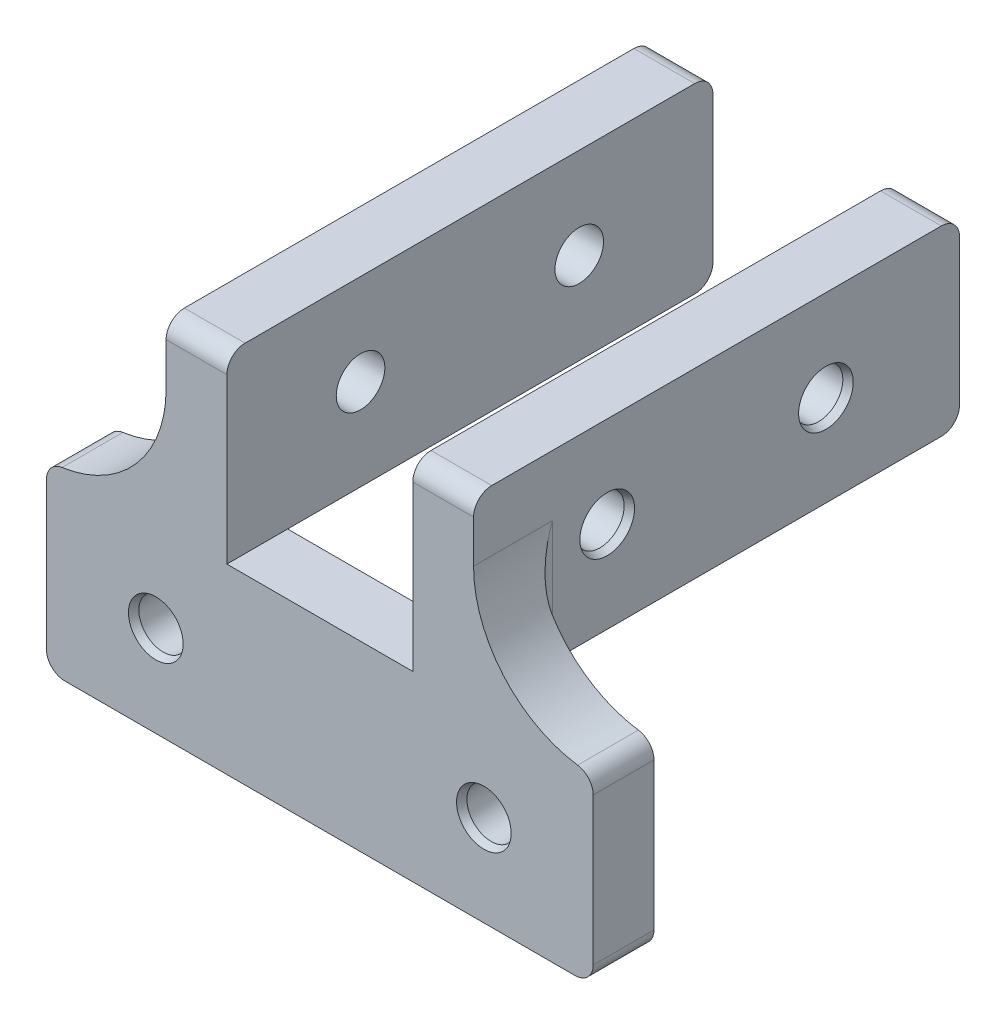
from build123d import *

# Parameters (mm, degrees)
SKETCH1_W                         = 45
SKETCH1_H                         = 15
BOSS_EXTRUDE1_DEPTH               = 5
BOSS_EXTRUDE2_DEPTH               = 15
F_4_0_4_DIAMETER_HOLE1_AT_2_COUNT = 2
F_4_0_4_DIAMETER_HOLE1_AT_2_PITCH = 18
F_4_0_4_DIAMETER_HOLE2_AT_2_COUNT = 2
F_4_0_4_DIAMETER_HOLE2_AT_2_PITCH = 27
FILLET1_R                         = 10
FILLET2_R                         = 1.5


with BuildPart() as part:
    # Sketch1 → Boss-Extrude1 (new body)
    with BuildSketch(Plane.XY):
        Rectangle(SKETCH1_W, SKETCH1_H)
    extrude(amount=BOSS_EXTRUDE1_DEPTH)

    # Sketch3 → Boss-Extrude2 (add)
    with BuildSketch(Plane(origin=(0, 7.5, 0), x_dir=(1, 0, 0), z_dir=(0, 1, 0))):
        Polygon((-7.65, 0), (-7.65, -5), (-12.65, -5), (-12.65, 35), (-7.65, 35), align=None)
        Polygon((7.65, -5), (12.65, -5), (12.65, 35), (7.65, 35), (7.65, 0), align=None)
    extrude(amount=BOSS_EXTRUDE2_DEPTH)

    # Sketch8 → Ø4.0 (4) Diameter Hole1 (revolve, cut)
    with BuildSketch(Plane(origin=(-12.65, 15, -24), x_dir=(0, 0, 1), z_dir=(0, 1, 0))):
        Polygon((0, 0), (0, 5), (2, 5), (2, 0.603553391), (2.25, 0), align=None)
    f_4_0_4_diameter_hole1 = revolve(axis=Axis((-19, 15, -24), (1, 0, 0)), mode=Mode.SUBTRACT)

    # Ø4.0 (4) Diameter Hole1 at 2: Ø4.0 (4) Diameter Hole1 ×2
    with Locations(*[(0, 0, i * F_4_0_4_DIAMETER_HOLE1_AT_2_PITCH) for i in range(1, F_4_0_4_DIAMETER_HOLE1_AT_2_COUNT)]):
        add(f_4_0_4_diameter_hole1, mode=Mode.SUBTRACT)

    # Mirror3: Ø4.0 (4) Diameter Hole1 across plane
    add(f_4_0_4_diameter_hole1.mirror(Plane(origin=(0, 0, 0), x_dir=(0, 0, 1), z_dir=(1, 0, 0))), mode=Mode.SUBTRACT)

    # Mirror3 copy 1 sketch → Mirror3 copy 1 (revolve, cut)
    with BuildSketch(Plane(origin=(12.65, 15, -6), x_dir=(0, 0, 1), z_dir=(0, 1, 0))):
        Polygon((0, 0), (0, -5), (2, -5), (2, -0.603553391), (2.25, 0), align=None)
    revolve(axis=Axis((19, 15, -6), (1, 0, 0)), mode=Mode.SUBTRACT)

    # Sketch12 → Ø4.0 (4) Diameter Hole2 (revolve, cut)
    with BuildSketch(Plane(origin=(13.5, 0, 5), x_dir=(0, -1, 0), z_dir=(1, 0, 0))):
        Polygon((0, 0), (0, 5), (2, 5), (2, 0.603553391), (2.25, 0), align=None)
    f_4_0_4_diameter_hole2 = revolve(axis=Axis((13.5, 0, 11.35), (0, 0, -1)), mode=Mode.SUBTRACT)

    # Ø4.0 (4) Diameter Hole2 at 2: Ø4.0 (4) Diameter Hole2 ×2
    with Locations(*[(-i * F_4_0_4_DIAMETER_HOLE2_AT_2_PITCH, 0, 0) for i in range(1, F_4_0_4_DIAMETER_HOLE2_AT_2_COUNT)]):
        add(f_4_0_4_diameter_hole2, mode=Mode.SUBTRACT)

    # Fillet1
    # the kernel refuses this fillet: 10 mm, written as the material it adds along each edge
    with BuildSketch(Plane(origin=(12.65, 7.5, 5), x_dir=(1, 0, 0), z_dir=(0, 0, -1))) as fillet1_piece_1:
        with BuildLine():
            CenterArc((10, -9.998874937), FILLET1_R, 90.859468925, 89.140531075)
            Line((0, -9.998874937), (0, 0))
            Line((0, 0), (9.85, 0))
        make_face()
    extrude(amount=5)
    with BuildSketch(Plane(origin=(-12.65, 7.5, 5), x_dir=(-1, 0, 0), z_dir=(0, 0, -1))) as fillet1_piece_2:
        with BuildLine():
            CenterArc((10, 9.998874937), FILLET1_R, 180, 89.140531075)
            Line((0, 9.998874937), (0, 0))
            Line((0, 0), (9.85, 0))
        make_face()
    extrude(amount=5)

    # Fillet2
    fillet2_edges = [part.edges().sort_by_distance(p)[0] for p in [
        (-10.15, 7.5, -35),
        (-10.15, 22.5, -35),
        (-10.15, 22.5, 5),
        (10.15, 7.5, -35),
        (10.15, 22.5, 5),
        (10.15, 22.5, -35),
        (22.5, -7.5, 2.5),
        (-22.5, -7.5, 2.5),
        (-22.5, 7.5, 2.5),
        (22.5, 7.5, 2.5),
        (12.65, 12.499437468, 0),
        (-12.65, 12.499437468, 0),
    ]]
    fillet(fillet2_edges, radius=FILLET2_R)


solid = part.part
